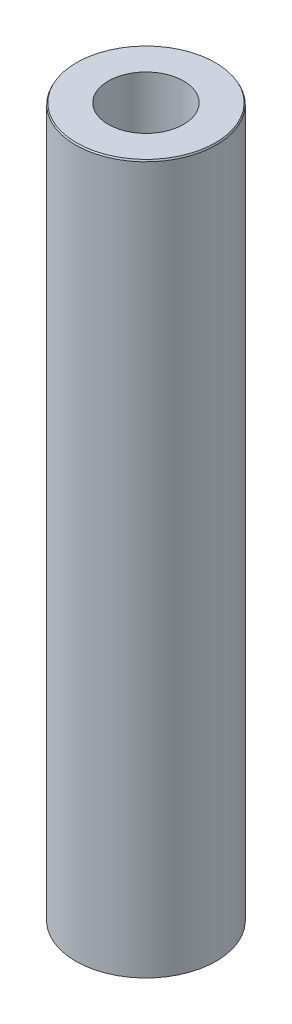
from build123d import *
from OCP.BRepFilletAPI import BRepFilletAPI_MakeChamfer

# Parameters (mm, degrees)
SKETCH1_R           = 47.5
BOSS_EXTRUDE1_DEPTH = 479.471370496
SKETCH2_R           = 25.449571922
CUT_EXTRUDE1_DEPTH  = 485.154205936
CHAMFER1_SIZE       = 1.045893665
CHAMFER1_SIZE2      = 0.543933611


with BuildPart() as part:
    # Sketch1 → Boss-Extrude1 (new body)
    with BuildSketch(Plane(origin=(0, 0, 0), x_dir=(1, 0, 0), z_dir=(0, 1, 0))):
        Circle(SKETCH1_R)
    extrude(amount=BOSS_EXTRUDE1_DEPTH)

    # Sketch2 → Cut-Extrude1 (cut, through all)
    with BuildSketch(Plane(origin=(0, 0, 0), x_dir=(1, 0, 0), z_dir=(0, 1, 0))):
        Circle(SKETCH2_R)
    extrude(amount=CUT_EXTRUDE1_DEPTH, mode=Mode.SUBTRACT)

    # Chamfer1: one chamfer whose edges measure the first distance from different faces: ONE call of the kernel's chamfer builder (chamfer() names one face for all edges)
    chamfer1_edges_1 = [part.edges().sort_by_distance(p)[0] for p in [
        (-47.5, 479.471370496, 0),
    ]]
    chamfer1_side_1 = [part.faces().sort_by_distance(p)[0] for p in [
        (-47.5, 239.735685248, 0),
    ]]
    chamfer1_edges_2 = [part.edges().sort_by_distance(p)[0] for p in [
        (-47.5, 0, 0),
    ]]
    chamfer1_side_2 = [part.faces().sort_by_distance(p)[0] for p in [
        (-46.156497116, 0, 0),
    ]]
    chamfer1 = BRepFilletAPI_MakeChamfer(part.part.solid().wrapped)
    for e in chamfer1_edges_1:
        chamfer1.Add(CHAMFER1_SIZE, CHAMFER1_SIZE2, e.wrapped, chamfer1_side_1[0].wrapped)  # the first distance lies on this face
    for e in chamfer1_edges_2:
        chamfer1.Add(CHAMFER1_SIZE, CHAMFER1_SIZE2, e.wrapped, chamfer1_side_2[0].wrapped)  # the first distance lies on this face
    add(Compound.cast(chamfer1.Shape()), mode=Mode.REPLACE)


solid = part.part
